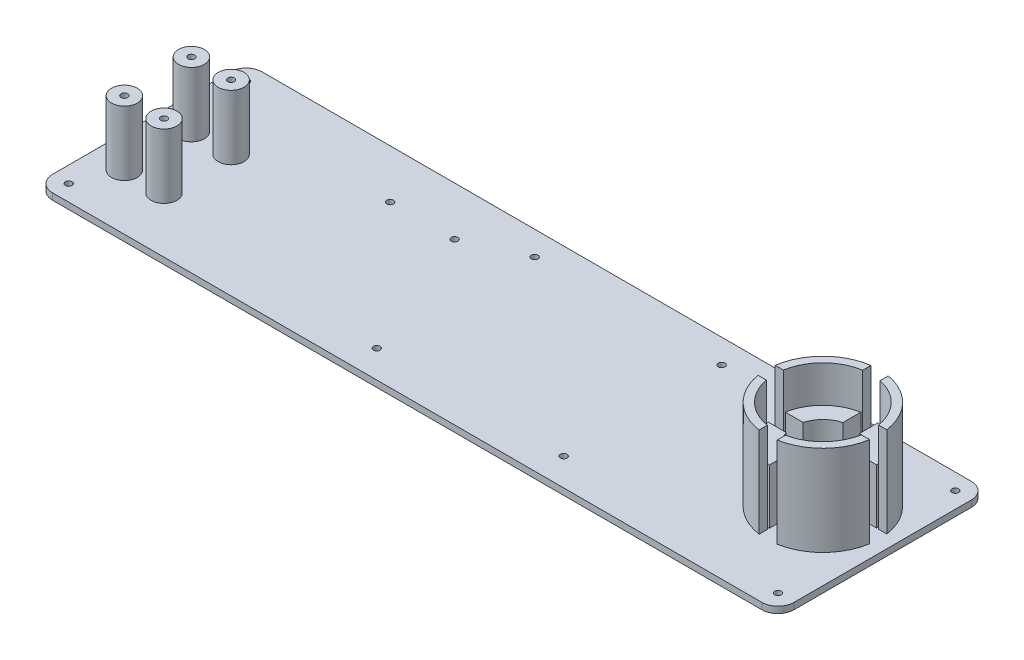
from build123d import *

# Parameters (mm, degrees)
SKETCH1_W                   = 230
SKETCH1_H                   = 65
BOSS_EXTRUDE1_DEPTH         = 2
M2_5_TAPPED_HOLE1_D         = 2.05
M2_5_TAPPED_HOLE1_DEPTH     = 2.5
M2_5_TAPPED_HOLE1_TIP       = 0.615882135
M2_5_TAPPED_HOLE2_D         = 2.05
M2_5_TAPPED_HOLE2_DEPTH     = 6.35
M2_5_TAPPED_HOLE2_TIP       = 0.615882135
SKETCH12_R                  = 4
BOSS_EXTRUDE4_DEPTH         = 20
FILLET1_R                   = 5
M2_5_TAPPED_HOLE3_D         = 2.05
M2_5_TAPPED_HOLE3_DEPTH     = 6.35
M2_5_TAPPED_HOLE3_TIP       = 0.615882135
M2_5_START                  = 2
M2_5_TAPPED_HOLE4_OUTLINE_R = 1.025
M2_5_TAPPED_HOLE4_DEPTH     = 20
M2_5_TAPPED_HOLE4_2_DEPTH   = 17
M2_5_START_2                = 19
M2_5_TAPPED_HOLE4_3_DEPTH   = 11
M2_5_TAPPED_HOLE5_OUTLINE_R = 1.025
M2_5_TAPPED_HOLE5_DEPTH     = 2


# Read off the part's stored shape, not the designer's step: M2.5 Tapped Hole4, M2.5 Tapped Hole5
with BuildPart() as part:
    # Sketch1 → Boss-Extrude1 (new body)
    with BuildSketch(Plane(origin=(0, 0, 0), x_dir=(1, 0, 0), z_dir=(0, 1, 0))):
        with Locations((115, 32.5)):
            Rectangle(SKETCH1_W, SKETCH1_H)
    extrude(amount=BOSS_EXTRUDE1_DEPTH)

    # M2.5 Tapped Hole1
    with Locations(Plane(origin=(0, 0, 0), x_dir=(-1, 0, 0), z_dir=(0, -1, 0))):
        with Locations((-97, 8.54131446), (-97, 57.54131446), (-155, 57.54131446), (-155, 8.54131446)):
            Hole(M2_5_TAPPED_HOLE1_D / 2, depth=M2_5_TAPPED_HOLE1_DEPTH)
            with Locations((0, 0, -(M2_5_TAPPED_HOLE1_DEPTH + M2_5_TAPPED_HOLE1_TIP / 2))):  # 118° drill point
                Cone(0, M2_5_TAPPED_HOLE1_D / 2, M2_5_TAPPED_HOLE1_TIP, mode=Mode.SUBTRACT)

    # M2.5 Tapped Hole2
    with Locations(Plane(origin=(0, 0, 0), x_dir=(-1, 0, 0), z_dir=(0, -1, 0))):
        with Locations((-10, 17.256022479), (-22.3, 17.256022479), (-22.3, 38.056022479), (-10, 38.056022479)):
            Hole(M2_5_TAPPED_HOLE2_D / 2, depth=M2_5_TAPPED_HOLE2_DEPTH)
            with Locations((0, 0, -(M2_5_TAPPED_HOLE2_DEPTH + M2_5_TAPPED_HOLE2_TIP / 2))):  # 118° drill point
                Cone(0, M2_5_TAPPED_HOLE2_D / 2, M2_5_TAPPED_HOLE2_TIP, mode=Mode.SUBTRACT)

    # Sketch12 → Boss-Extrude4 (add)
    with BuildSketch(Plane(origin=(0, 2, 0), x_dir=(1, 0, 0), z_dir=(0, 1, 0))):
        with Locations(Location((10, 38.056022479, 0), (0, 0, 90))):
            Circle(SKETCH12_R)
        with Locations(Location((22.3, 38.056022479, 0), (0, 0, 90))):
            Circle(SKETCH12_R)
        with Locations(Location((10, 17.256022479, 0), (0, 0, 90))):
            Circle(SKETCH12_R)
        with Locations(Location((22.3, 17.256022479, 0), (0, 0, 90))):
            Circle(SKETCH12_R)
    extrude(amount=BOSS_EXTRUDE4_DEPTH)

    # Fillet1
    fillet1_edges = [part.edges().sort_by_distance(p)[0] for p in [
        (0, 1, -65),
        (230, 1, -65),
        (230, 1, 0),
        (0, 1, 0),
    ]]
    fillet(fillet1_edges, radius=FILLET1_R)

    # M2.5 Tapped Hole3
    with Locations(Plane(origin=(5, 0, -5), x_dir=(0, 0, -1), z_dir=(0, -1, 0))):
        with Locations((0, 0), (0, 220), (55, 220), (55, 0)):
            Hole(M2_5_TAPPED_HOLE3_D / 2, depth=M2_5_TAPPED_HOLE3_DEPTH)
            with Locations((0, 0, -(M2_5_TAPPED_HOLE3_DEPTH + M2_5_TAPPED_HOLE3_TIP / 2))):  # 118° drill point
                Cone(0, M2_5_TAPPED_HOLE3_D / 2, M2_5_TAPPED_HOLE3_TIP, mode=Mode.SUBTRACT)

    # M2.5 Tapped Hole4 outline → M2.5 Tapped Hole4 (cut)
    with BuildSketch(Plane(origin=(0, 0, 0), x_dir=(1, 0, 0), z_dir=(0, 1, 0)).offset(M2_5_START)):
        with Locations((10, 38.056022479)):
            Circle(M2_5_TAPPED_HOLE4_OUTLINE_R)
        with Locations((22.3, 38.056022479)):
            Circle(M2_5_TAPPED_HOLE4_OUTLINE_R)
        with Locations((22.3, 17.256022479)):
            Circle(M2_5_TAPPED_HOLE4_OUTLINE_R)
        with Locations((10, 17.256022479)):
            Circle(M2_5_TAPPED_HOLE4_OUTLINE_R)
    extrude(amount=M2_5_TAPPED_HOLE4_DEPTH, mode=Mode.SUBTRACT)

    # M2.5 Tapped Hole4 2 outline → M2.5 Tapped Hole4 2 (add)
    with BuildSketch(Plane(origin=(0, 0, 0), x_dir=(1, 0, 0), z_dir=(0, 1, 0)).offset(M2_5_START)):
        with BuildLine():
            ThreePointArc((211.782562929, 17.990693318), (221.179581033, 22.937725916), (225.985844998, 32.407515116))
            Line((225.985844998, 32.407515116), (223.447313577, 32.407515116))
            ThreePointArc((223.447313577, 32.407515116), (219.412240688, 24.706042811), (211.782562929, 20.536809526))
            Line((211.782562929, 20.536809526), (211.782562929, 17.990693318))
        make_face()
        with BuildLine():
            ThreePointArc((226.030319518, 37.74300987), (221.281519671, 47.396787308), (211.782562929, 52.448157384))
            Line((211.782562929, 52.448157384), (211.782562929, 49.902041176))
            ThreePointArc((211.782562929, 49.902041176), (219.514410141, 45.6278138), (223.499425569, 37.74300987))
            Line((223.499425569, 37.74300987), (226.030319518, 37.74300987))
        make_face()
        with BuildLine():
            ThreePointArc((206.276217111, 52.548907703), (196.36982105, 47.624674517), (191.39614442, 37.74300987))
            Line((191.39614442, 37.74300987), (193.927038369, 37.74300987))
            ThreePointArc((193.927038369, 37.74300987), (198.137709859, 45.857015872), (206.276217111, 50.020133394))
            Line((206.276217111, 50.020133394), (206.276217111, 52.548907703))
        make_face()
        with BuildLine():
            ThreePointArc((191.440618941, 32.407515116), (196.473651384, 22.711721041), (206.276217111, 17.889942999))
            Line((206.276217111, 17.889942999), (206.276217111, 20.418717308))
            ThreePointArc((206.276217111, 20.418717308), (198.242107068, 24.479055557), (193.979150361, 32.407515116))
            Line((193.979150361, 32.407515116), (191.440618941, 32.407515116))
        make_face()
        with BuildLine():
            ThreePointArc((211.782562929, 21.150338406), (218.988116471, 25.13048346), (222.836020675, 32.407515116))
            Line((222.836020675, 32.407515116), (217.262685801, 32.407515116))
            ThreePointArc((217.262685801, 32.407515116), (215.172762854, 28.952491432), (211.782562929, 26.758975749))
            Line((211.782562929, 26.758975749), (211.782562929, 21.150338406))
        make_face()
        with BuildLine():
            ThreePointArc((222.89037982, 37.74300987), (219.090366179, 45.203166413), (211.782562929, 49.288512296))
            Line((211.782562929, 49.288512296), (211.782562929, 43.679874952))
            ThreePointArc((211.782562929, 43.679874952), (215.276963699, 41.377138058), (217.352185678, 37.74300987))
            Line((217.352185678, 37.74300987), (222.89037982, 37.74300987))
        make_face()
        with BuildLine():
            ThreePointArc((206.276217111, 49.411710529), (198.562013106, 45.432786972), (194.536084119, 37.74300987))
            Line((194.536084119, 37.74300987), (200.074278261, 37.74300987))
            ThreePointArc((200.074278261, 37.74300987), (202.381190604, 41.615146745), (206.276217111, 43.883198119))
            Line((206.276217111, 43.883198119), (206.276217111, 49.411710529))
        make_face()
        with BuildLine():
            ThreePointArc((194.590443263, 32.407515116), (198.666590392, 24.903176371), (206.276217111, 21.027140173))
            Line((206.276217111, 21.027140173), (206.276217111, 26.555652583))
            ThreePointArc((206.276217111, 26.555652583), (202.489350756, 28.718402151), (200.163778137, 32.407515116))
            Line((200.163778137, 32.407515116), (194.590443263, 32.407515116))
        make_face()
    extrude(amount=M2_5_TAPPED_HOLE4_2_DEPTH)

    # M2.5 Tapped Hole4 3 outline → M2.5 Tapped Hole4 3 (add)
    with BuildSketch(Plane(origin=(0, 0, 0), x_dir=(1, 0, 0), z_dir=(0, 1, 0)).offset(M2_5_START_2)):
        with BuildLine():
            ThreePointArc((211.782562929, 17.990693318), (221.179581033, 22.937725916), (225.985844998, 32.407515116))
            Line((225.985844998, 32.407515116), (223.447313577, 32.407515116))
            ThreePointArc((223.447313577, 32.407515116), (219.412240688, 24.706042811), (211.782562929, 20.536809526))
            Line((211.782562929, 20.536809526), (211.782562929, 17.990693318))
        make_face()
        with BuildLine():
            ThreePointArc((226.030319518, 37.74300987), (221.281519671, 47.396787308), (211.782562929, 52.448157384))
            Line((211.782562929, 52.448157384), (211.782562929, 49.902041176))
            ThreePointArc((211.782562929, 49.902041176), (219.514410141, 45.6278138), (223.499425569, 37.74300987))
            Line((223.499425569, 37.74300987), (226.030319518, 37.74300987))
        make_face()
        with BuildLine():
            ThreePointArc((206.276217111, 52.548907703), (196.36982105, 47.624674517), (191.39614442, 37.74300987))
            Line((191.39614442, 37.74300987), (193.927038369, 37.74300987))
            ThreePointArc((193.927038369, 37.74300987), (198.137709859, 45.857015872), (206.276217111, 50.020133394))
            Line((206.276217111, 50.020133394), (206.276217111, 52.548907703))
        make_face()
        with BuildLine():
            ThreePointArc((191.440618941, 32.407515116), (196.473651384, 22.711721041), (206.276217111, 17.889942999))
            Line((206.276217111, 17.889942999), (206.276217111, 20.418717308))
            ThreePointArc((206.276217111, 20.418717308), (198.242107068, 24.479055557), (193.979150361, 32.407515116))
            Line((193.979150361, 32.407515116), (191.440618941, 32.407515116))
        make_face()
    extrude(amount=M2_5_TAPPED_HOLE4_3_DEPTH)

    # M2.5 Tapped Hole5 outline → M2.5 Tapped Hole5 (cut)
    with BuildSketch(Plane(origin=(0, 0, 0), x_dir=(1, 0, 0), z_dir=(0, 1, 0))):
        with Locations((79.821651761, 49.876027086)):
            Circle(M2_5_TAPPED_HOLE5_OUTLINE_R)
        with Locations((59.821651761, 49.876027086)):
            Circle(M2_5_TAPPED_HOLE5_OUTLINE_R)
    extrude(amount=M2_5_TAPPED_HOLE5_DEPTH, mode=Mode.SUBTRACT)


solid = part.part
